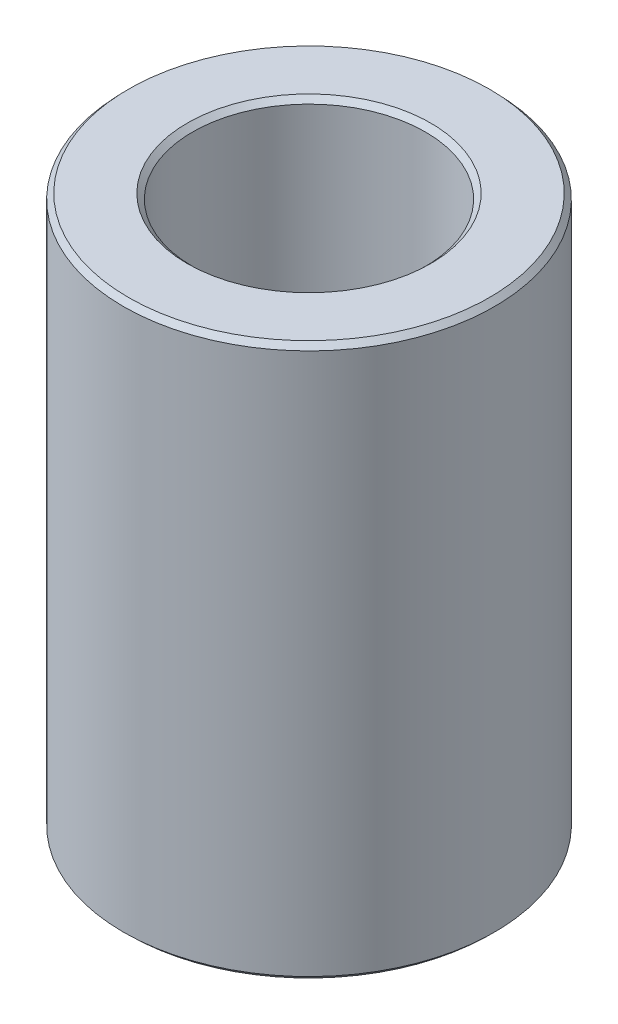
from build123d import *
from OCP.BRepFilletAPI import BRepFilletAPI_MakeChamfer

# Parameters (mm, degrees)
SKETCH1_R           = 35
BOSS_EXTRUDE1_DEPTH = 104.165975309
SKETCH2_R           = 21.967302751
CUT_EXTRUDE1_DEPTH  = 116.328012261
CHAMFER1_SIZE       = 1.001763291
CHAMFER1_SIZE2      = 0.952306027


with BuildPart() as part:
    # Sketch1 → Boss-Extrude1 (new body)
    with BuildSketch(Plane(origin=(0, 0, 0), x_dir=(1, 0, 0), z_dir=(0, 1, 0))):
        Circle(SKETCH1_R)
    extrude(amount=BOSS_EXTRUDE1_DEPTH)

    # Sketch2 → Cut-Extrude1 (cut, through all)
    with BuildSketch(Plane(origin=(0, 0, 0), x_dir=(1, 0, 0), z_dir=(0, 1, 0))):
        Circle(SKETCH2_R)
    extrude(amount=CUT_EXTRUDE1_DEPTH, mode=Mode.SUBTRACT)

    # Chamfer1: one chamfer whose edges measure the first distance from different faces: ONE call of the kernel's chamfer builder (chamfer() names one face for all edges)
    chamfer1_edges_1 = [part.edges().sort_by_distance(p)[0] for p in [
        (-21.967302751, 104.165975309, 0),
    ]]
    chamfer1_side_1 = [part.faces().sort_by_distance(p)[0] for p in [
        (-34.010050506, 104.165975309, 0),
    ]]
    chamfer1_edges_2 = [part.edges().sort_by_distance(p)[0] for p in [
        (-21.967302751, 0, 0),
    ]]
    chamfer1_side_2 = [part.faces().sort_by_distance(p)[0] for p in [
        (-21.967302751, 52.082987654, 0),
    ]]
    chamfer1_edges_3 = [part.edges().sort_by_distance(p)[0] for p in [
        (-35, 0, 0),
    ]]
    chamfer1_side_3 = [part.faces().sort_by_distance(p)[0] for p in [
        (-34.010050506, 0, 0),
    ]]
    chamfer1_edges_4 = [part.edges().sort_by_distance(p)[0] for p in [
        (-35, 104.165975309, 0),
    ]]
    chamfer1_side_4 = [part.faces().sort_by_distance(p)[0] for p in [
        (-35, 52.082987654, 0),
    ]]
    chamfer1 = BRepFilletAPI_MakeChamfer(part.part.solid().wrapped)
    for e in chamfer1_edges_1:
        chamfer1.Add(CHAMFER1_SIZE, CHAMFER1_SIZE2, e.wrapped, chamfer1_side_1[0].wrapped)  # the first distance lies on this face
    for e in chamfer1_edges_2:
        chamfer1.Add(CHAMFER1_SIZE, CHAMFER1_SIZE2, e.wrapped, chamfer1_side_2[0].wrapped)  # the first distance lies on this face
    for e in chamfer1_edges_3:
        chamfer1.Add(CHAMFER1_SIZE, CHAMFER1_SIZE2, e.wrapped, chamfer1_side_3[0].wrapped)  # the first distance lies on this face
    for e in chamfer1_edges_4:
        chamfer1.Add(CHAMFER1_SIZE, CHAMFER1_SIZE2, e.wrapped, chamfer1_side_4[0].wrapped)  # the first distance lies on this face
    add(Compound.cast(chamfer1.Shape()), mode=Mode.REPLACE)


solid = part.part
